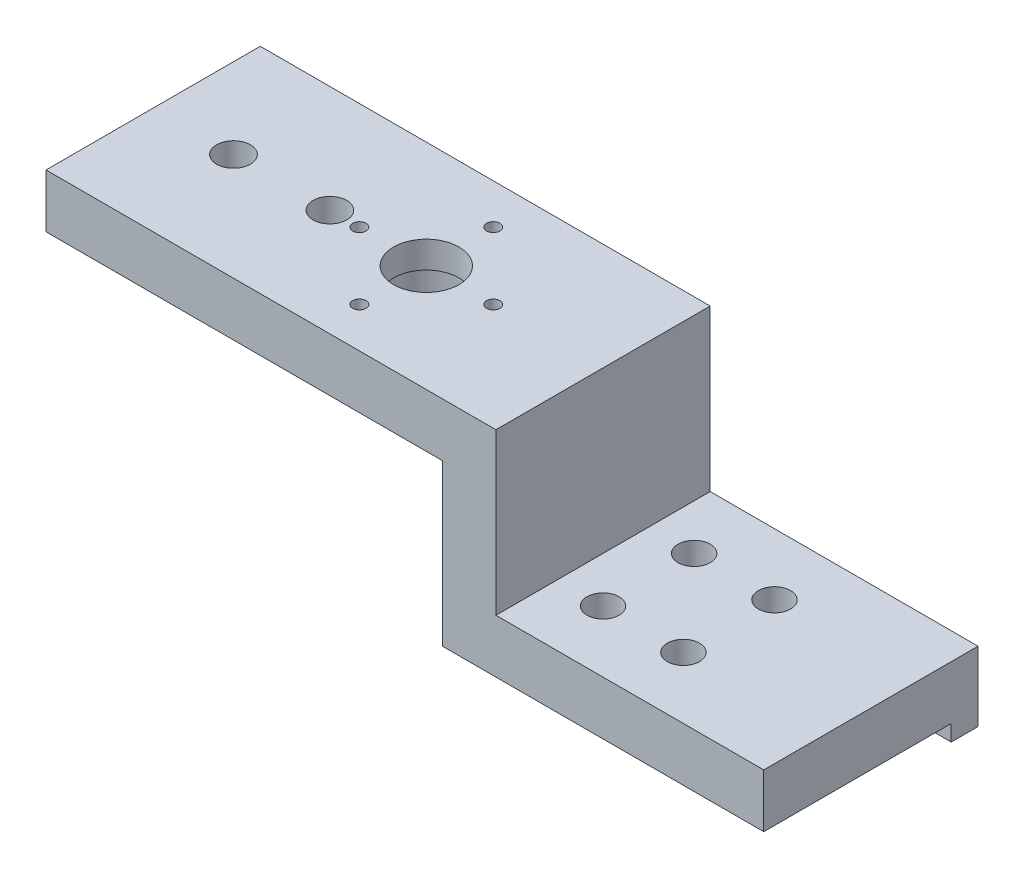
from build123d import *

# Parameters (mm, degrees)
SKETCH1_W           = 60
SKETCH1_H           = 40
BOSS_EXTRUDE1_DEPTH = 10
SKETCH2_W           = 10
SKETCH2_H           = 40
BOSS_EXTRUDE2_DEPTH = 30
SKETCH3_W           = 40
SKETCH3_H           = 10
BOSS_EXTRUDE3_DEPTH = 74
SKETCH4_R           = 6.1
SKETCH4_R_2         = 3.15
CUT_EXTRUDE1_DEPTH  = 74
SKETCH5_R           = 3
CUT_EXTRUDE2_DEPTH  = 74
SKETCH6_R           = 3.5
CUT_EXTRUDE3_DEPTH  = 3
SKETCH7_R           = 6.5
CUT_EXTRUDE4_DEPTH  = 5
M3_TAPPED_HOLE1_D   = 2.5
CIRPATTERN1_COUNT   = 4
SKETCH10_W          = 60
SKETCH10_H          = 5
BOSS_EXTRUDE4_DEPTH = 3


with BuildPart() as part:
    # Sketch1 → Boss-Extrude1 (new body)
    with BuildSketch(Plane(origin=(0, 0, 0), x_dir=(1, 0, 0), z_dir=(0, 1, 0))):
        Rectangle(SKETCH1_W, SKETCH1_H)
    extrude(amount=BOSS_EXTRUDE1_DEPTH)

    # Sketch2 → Boss-Extrude2 (add)
    with BuildSketch(Plane(origin=(0, 10, 0), x_dir=(1, 0, 0), z_dir=(0, 1, 0))):
        with Locations((-25, 0)):
            Rectangle(SKETCH2_W, SKETCH2_H)
    extrude(amount=BOSS_EXTRUDE2_DEPTH)

    # Sketch3 → Boss-Extrude3 (add)
    with BuildSketch(Plane.ZY.offset(30)):
        with Locations((0, 35)):
            Rectangle(SKETCH3_W, SKETCH3_H)
    extrude(amount=BOSS_EXTRUDE3_DEPTH)

    # Sketch4 → Cut-Extrude1 (cut)
    with BuildSketch(Plane.XZ.offset(-30)):
        with Locations((-53, 0)):
            Circle(SKETCH4_R)
        with Locations((-71, 0)):
            Circle(SKETCH4_R_2)
        with Locations((-89, 0)):
            Circle(SKETCH4_R_2)
    extrude(amount=-CUT_EXTRUDE1_DEPTH, mode=Mode.SUBTRACT)

    # Sketch5 → Cut-Extrude2 (cut)
    with BuildSketch(Plane.XZ):
        with Locations((-11.5, 8.5)):
            Circle(SKETCH5_R)
        with Locations((-11.5, -8.5)):
            Circle(SKETCH5_R)
        with Locations((3.5, 8.5)):
            Circle(SKETCH5_R)
        with Locations((3.5, -8.5)):
            Circle(SKETCH5_R)
    extrude(amount=-CUT_EXTRUDE2_DEPTH, mode=Mode.SUBTRACT)

    # Sketch6 → Cut-Extrude3 (cut)
    with BuildSketch(Plane.XZ.offset(-30)):
        with Locations((-89, 0)):
            Circle(SKETCH6_R)
        with Locations((-71, 0)):
            Circle(SKETCH6_R)
    extrude(amount=-CUT_EXTRUDE3_DEPTH, mode=Mode.SUBTRACT)

    # Sketch7 → Cut-Extrude4 (cut)
    with BuildSketch(Plane.XZ.offset(-30)):
        with Locations((-53, 0)):
            Circle(SKETCH7_R)
    extrude(amount=-CUT_EXTRUDE4_DEPTH, mode=Mode.SUBTRACT)

    # M3 Tapped Hole1 (through all)
    with Locations(Plane(origin=(0, 40, 0), x_dir=(1, 0, 0), z_dir=(0, 1, 0))):
        with Locations((-53, 12.5)):
            m3_tapped_hole1 = Hole(M3_TAPPED_HOLE1_D / 2)

    # CirPattern1: M3 Tapped Hole1 ×4 about axis
    cirpattern1_axis = Axis((-53, 40, 0), (0, 1, 0))
    for i in range(1, CIRPATTERN1_COUNT):
        add(m3_tapped_hole1.rotate(cirpattern1_axis, i * 360 / CIRPATTERN1_COUNT), mode=Mode.SUBTRACT)

    # Sketch10 → Boss-Extrude4 (add)
    with BuildSketch(Plane.XZ):
        with Locations((0, -17.5)):
            Rectangle(SKETCH10_W, SKETCH10_H)
    extrude(amount=BOSS_EXTRUDE4_DEPTH)


solid = part.part
